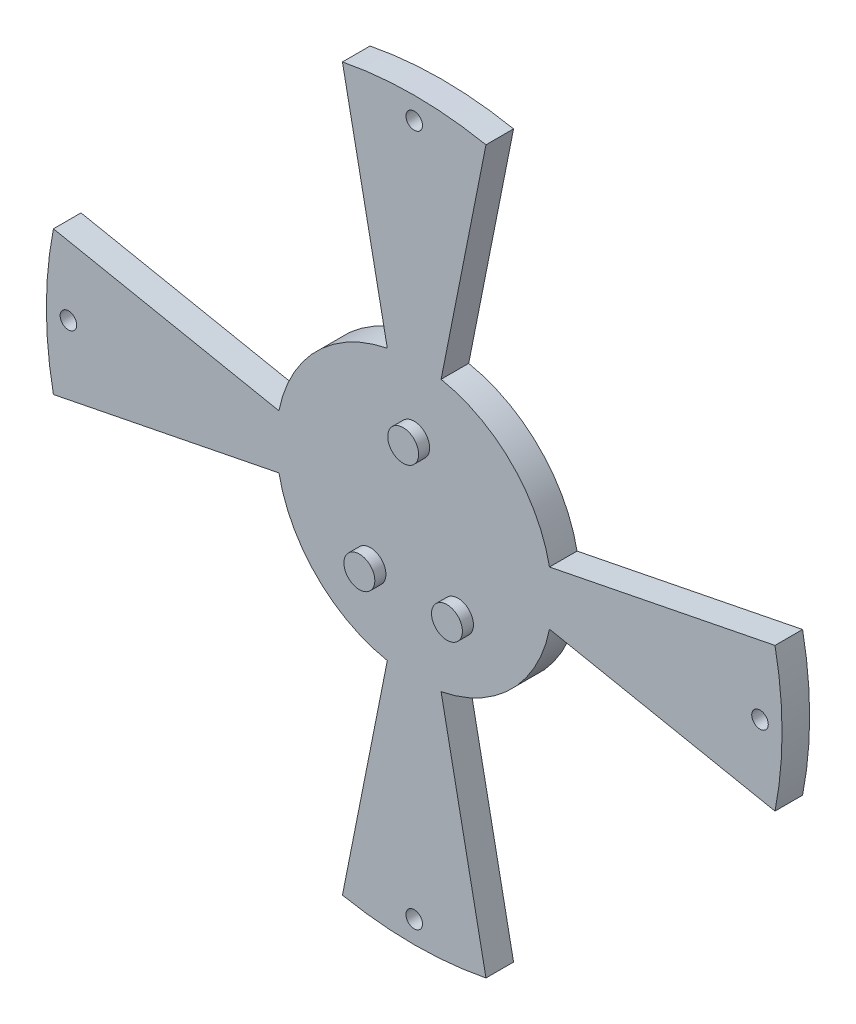
from build123d import *

# Parameters (mm, degrees)
SKETCH1_R      = 25
EXTRUDE1_DEPTH = 5
SKETCH4_R      = 1.5
EXTRUDE2_DEPTH = 5
SKETCH6_R      = 2.8
EXTRUDE4_DEPTH = 2


with BuildPart() as part:
    # Sketch1 → Extrude1 (new body)
    with BuildSketch(Plane.XY):
        Circle(SKETCH1_R)
    extrude(amount=EXTRUDE1_DEPTH)

    # Sketch4 → Extrude2 (add)
    # profile 1 of 4: a face of its own
    with BuildSketch(Plane.XY.offset(5)):
        with BuildLine():
            Line((-13.007376983, 65.393912324), (-4.682070455, 23.538866078))
            ThreePointArc((-4.682070455, 23.538866078), (0, 24), (4.682070455, 23.538866078))
            Line((4.682070455, 23.538866078), (13.007376983, 65.393912324))
            ThreePointArc((13.007376983, 65.393912324), (0, 66.675), (-13.007376983, 65.393912324))
        make_face()
        with Locations((0, 62.675)):
            Circle(SKETCH4_R, mode=Mode.SUBTRACT)
    # profile 2 of 4: a face of its own
    with BuildSketch(Plane.XY.offset(5)):
        with BuildLine():
            Line((65.393912324, 13.007376983), (23.538866078, 4.682070455))
            ThreePointArc((23.538866078, 4.682070455), (24, 0), (23.538866078, -4.682070455))
            Line((23.538866078, -4.682070455), (65.393912324, -13.007376983))
            ThreePointArc((65.393912324, -13.007376983), (66.675, 0), (65.393912324, 13.007376983))
        make_face()
        with Locations((62.675, 0)):
            Circle(SKETCH4_R, mode=Mode.SUBTRACT)
    # profile 3 of 4: a face of its own
    with BuildSketch(Plane.XY.offset(5)):
        with BuildLine():
            Line((4.682070455, -23.538866078), (13.007376983, -65.393912324))
            ThreePointArc((13.007376983, -65.393912324), (0, -66.675), (-13.007376983, -65.393912324))
            Line((-13.007376983, -65.393912324), (-4.682070455, -23.538866078))
            ThreePointArc((-4.682070455, -23.538866078), (0, -24), (4.682070455, -23.538866078))
        make_face()
        with Locations((0, -62.675)):
            Circle(SKETCH4_R, mode=Mode.SUBTRACT)
    # profile 4 of 4: a face of its own
    with BuildSketch(Plane.XY.offset(5)):
        with BuildLine():
            Line((-23.538866078, -4.682070455), (-65.393912324, -13.007376983))
            ThreePointArc((-65.393912324, -13.007376983), (-66.675, 0), (-65.393912324, 13.007376983))
            Line((-65.393912324, 13.007376983), (-23.538866078, 4.682070455))
            ThreePointArc((-23.538866078, 4.682070455), (-24, 0), (-23.538866078, -4.682070455))
        make_face()
        with Locations((-62.675, 0)):
            Circle(SKETCH4_R, mode=Mode.SUBTRACT)
    extrude(amount=-EXTRUDE2_DEPTH)

    # Sketch6 → Extrude4 (add)
    with BuildSketch(Plane.XY.offset(5)):
        with Locations((-7.9375, -11.1125)):
            Circle(SKETCH6_R)
        with Locations((7.9375, -11.1125)):
            Circle(SKETCH6_R)
        with Locations((0, 12.7)):
            Circle(SKETCH6_R)
    extrude(amount=EXTRUDE4_DEPTH)


solid = part.part
